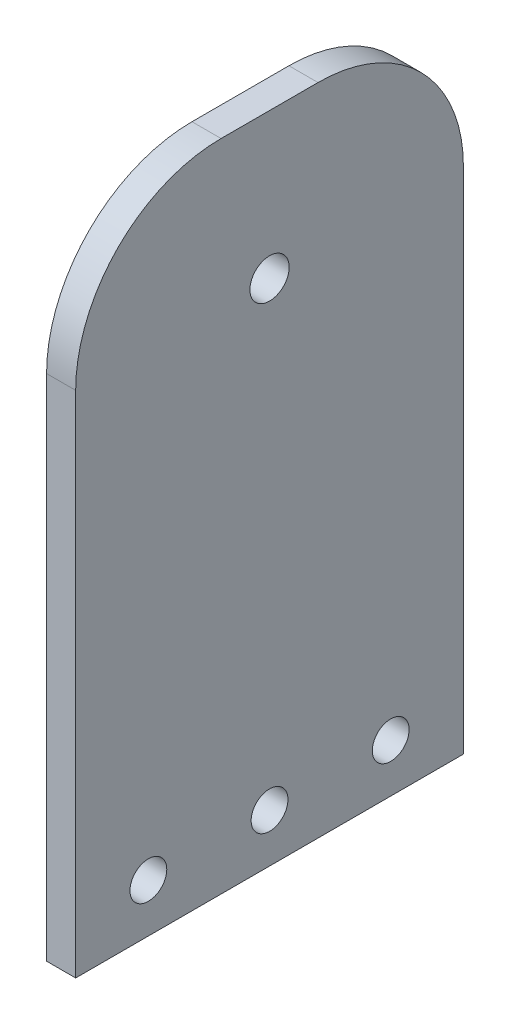
from build123d import *

# Parameters (mm, degrees)
BOSS_EXTRUDE1_DEPTH   = 3
F_6_CLEARANCE_HOLE2_D = 3.7973
SKETCH10_R            = 2.025
CUT_EXTRUDE1_DEPTH    = 10


with BuildPart() as part:
    # Sketch1 → Boss-Extrude1 (new body)
    with BuildSketch(Plane(origin=(0, 0, 0), x_dir=(0, 0, -1), z_dir=(1, 0, 0))):
        with BuildLine():
            Line((0, 52.5), (0, 0))
            Line((0, 0), (40, 0))
            Line((40, 0), (40, 52.5))
            ThreePointArc((40, 52.5), (35.606601718, 63.106601718), (25, 67.5))
            Line((25, 67.5), (15, 67.5))
            ThreePointArc((15, 67.5), (4.393398282, 63.106601718), (0, 52.5))
        make_face()
    extrude(amount=BOSS_EXTRUDE1_DEPTH)

    # #6 Clearance Hole2 (through all)
    with Locations(Plane(origin=(3, 0, 0), x_dir=(0, 0, -1), z_dir=(1, 0, 0))):
        with Locations((7.5, 5), (20, 5), (32.5, 5)):
            Hole(F_6_CLEARANCE_HOLE2_D / 2)

    # Sketch10 → Cut-Extrude1 (cut)
    with BuildSketch(Plane(origin=(3, 0, 0), x_dir=(0, 0, -1), z_dir=(1, 0, 0))):
        with Locations((20, 52.5)):
            Circle(SKETCH10_R)
    extrude(amount=-CUT_EXTRUDE1_DEPTH, mode=Mode.SUBTRACT)


solid = part.part
